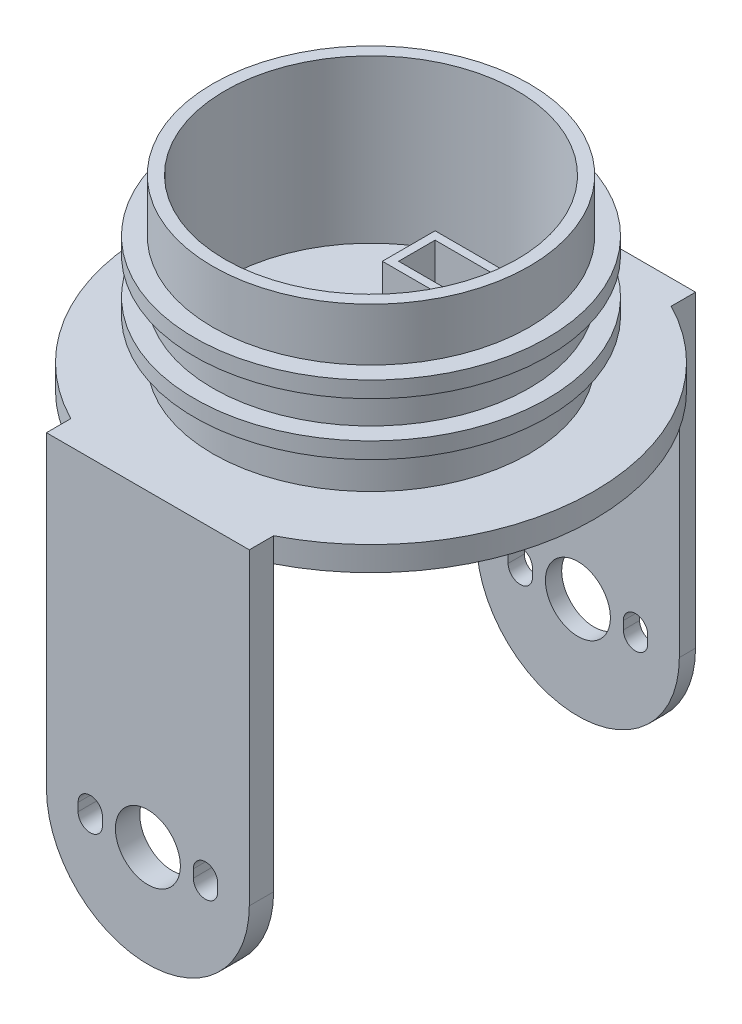
from build123d import *
from build123d.topology import SkipClean

# Parameters (mm, degrees)
SKETCH_1_R           = 19.5
SKETCH_1_R_2         = 18
EXTRUDE_1_DEPTH      = 20
SKETCH_3_R           = 27.5
EXTRUDE_2_DEPTH      = 3
EXTRUDE_START        = 2
SKETCH_25_R          = 21.75
SKETCH_25_R_2        = 19.5
EXTRUDE_12_DEPTH     = 2
EXTRUDE_START_2      = -1
SKETCH_26_R          = 21.75
SKETCH_26_R_2        = 19.5
EXTRUDE_13_DEPTH     = 2
SKETCH_27_W          = 25
SKETCH_27_H          = 51
EXTRUDE_14_DEPTH     = 3
SKETCH_28_R          = 4
EXTRUDE_17_DEPTH     = 2
EXTRUDE_START_3      = -53
SKETCH_28_15_R       = 4
EXTRUDE_19_DEPTH     = 53
SKETCH_32_W          = 2.204369859
SKETCH_32_H          = 3
EXTRUDE_20_DEPTH     = 2
CUT_EXTRUDE_START    = -50
SKETCH_28_18_R       = 4
CUT_EXTRUDE_8_DEPTH  = 50
SKETCH_33_W          = 25
SKETCH_33_H          = 3
EXTRUDE_21_DEPTH     = 3
SKETCH_34_W          = 10.2
SKETCH_34_H          = 6.5
SKETCH_34_W_2        = 8.2
SKETCH_34_H_2        = 4.5
EXTRUDE_22_DEPTH     = 5
SKETCH_37_W          = 8.2
SKETCH_37_H          = 4.5
CUT_EXTRUDE_9_DEPTH  = 5
SKETCH_38_R          = 6.3
SKETCH_38_R_2        = 4.8
EXTRUDE_23_DEPTH     = 9
CUT_EXTRUDE_10_DEPTH = 9.5
EXTRUDE_START_4      = 3
EXTRUDE_24_DEPTH     = 3


with BuildPart() as part:
    # 草圖1 → 填料-伸長1 (new body)
    with BuildSketch(Plane(origin=(0, 0, 0), x_dir=(1, 0, 0), z_dir=(0, 1, 0))):
        Circle(SKETCH_1_R)
        Circle(SKETCH_1_R_2, mode=Mode.SUBTRACT)
    extrude(amount=EXTRUDE_1_DEPTH)

    # 草圖3 → 填料-伸長2 (add)
    with BuildSketch(Plane.XZ):
        Circle(SKETCH_3_R)
    extrude(amount=EXTRUDE_2_DEPTH)

    # 草圖25 → 填料-伸長12 (add)
    with BuildSketch(Plane(origin=(0, 7, 0), x_dir=(-1, 0, 0), z_dir=(0, -1, 0)).offset(EXTRUDE_START)):
        Circle(SKETCH_25_R)
        Circle(SKETCH_25_R_2, mode=Mode.SUBTRACT)
    extrude(amount=-EXTRUDE_12_DEPTH)

    # 草圖26 → 填料-伸長13 (add)
    with BuildSketch(Plane(origin=(0, 10.5, 0), x_dir=(-1, 0, 0), z_dir=(0, -1, 0)).offset(EXTRUDE_START_2)):
        Circle(SKETCH_26_R)
        Circle(SKETCH_26_R_2, mode=Mode.SUBTRACT)
    extrude(amount=-EXTRUDE_13_DEPTH)

    # 草圖27 → 填料-伸長14 (add)
    with BuildSketch(Plane.XZ.offset(3)):
        Rectangle(SKETCH_27_W, SKETCH_27_H)
    extrude(amount=-EXTRUDE_14_DEPTH)

    # 草圖28 → 填料-伸長17 (add)
    with BuildSketch(Plane(origin=(0, 0, -25.5), x_dir=(-1, 0, 0), z_dir=(0, 0, -1))):
        with BuildLine():
            Line((12.5, 0), (-12.5, 0))
            Line((-12.5, 0), (-12.5, -38))
            ThreePointArc((-12.5, -38), (0, -50.5), (12.5, -38))
            Line((12.5, -38), (12.5, 0))
        make_face()
        with BuildLine():
            Line((8.6, -37.5), (8.6, -38.5))
            ThreePointArc((8.6, -38.5), (7.1, -40), (5.6, -38.5))
            Line((5.6, -38.5), (5.6, -37.5))
            ThreePointArc((5.6, -37.5), (7.1, -36), (8.6, -37.5))
        make_face(mode=Mode.SUBTRACT)
        with Locations((0, -38)):
            Circle(SKETCH_28_R, mode=Mode.SUBTRACT)
        with BuildLine():
            Line((-5.6, -37.5), (-5.6, -38.5))
            ThreePointArc((-5.6, -38.5), (-7.1, -40), (-8.6, -38.5))
            Line((-8.6, -38.5), (-8.6, -37.5))
            ThreePointArc((-8.6, -37.5), (-7.1, -36), (-5.6, -37.5))
        make_face(mode=Mode.SUBTRACT)
    extrude(amount=EXTRUDE_17_DEPTH)

    # 草圖28<15> → 填料-伸長19 (add)
    with BuildSketch(Plane(origin=(0, 0, -25.5), x_dir=(-1, 0, 0), z_dir=(0, 0, -1)).offset(EXTRUDE_START_3)):
        with BuildLine():
            Line((12.5, -38), (12.5, -3))
            Line((12.5, -3), (-12.5, -3))
            Line((-12.5, -3), (-12.5, -38))
            ThreePointArc((-12.5, -38), (0, -50.5), (12.5, -38))
        make_face()
        with BuildLine():
            Line((8.6, -37.5), (8.6, -38.5))
            ThreePointArc((8.6, -38.5), (7.1, -40), (5.6, -38.5))
            Line((5.6, -38.5), (5.6, -37.5))
            ThreePointArc((5.6, -37.5), (7.1, -36), (8.6, -37.5))
        make_face(mode=Mode.SUBTRACT)
        with Locations((0, -38)):
            Circle(SKETCH_28_15_R, mode=Mode.SUBTRACT)
        with BuildLine():
            Line((-5.6, -37.5), (-5.6, -38.5))
            ThreePointArc((-5.6, -38.5), (-7.1, -40), (-8.6, -38.5))
            Line((-8.6, -38.5), (-8.6, -37.5))
            ThreePointArc((-8.6, -37.5), (-7.1, -36), (-5.6, -37.5))
        make_face(mode=Mode.SUBTRACT)
    extrude(amount=EXTRUDE_19_DEPTH)

    # 草圖32 → 填料-伸長20 (add)
    with BuildSketch(Plane.XY.offset(25.5)):
        with Locations((11.397815071, -1.5)):
            Rectangle(SKETCH_32_W, SKETCH_32_H)
        with Locations((-11.397815071, -1.5)):
            Rectangle(SKETCH_32_W, SKETCH_32_H)
    extrude(amount=EXTRUDE_20_DEPTH)

    # 草圖28<18> → 除料-伸長8 (cut)
    with BuildSketch(Plane(origin=(0, 0, -25.5), x_dir=(-1, 0, 0), z_dir=(0, 0, -1)).offset(CUT_EXTRUDE_START)):
        with BuildLine():
            Line((12.5, -38), (12.5, -3))
            Line((12.5, -3), (-12.5, -3))
            Line((-12.5, -3), (-12.5, -38))
            ThreePointArc((-12.5, -38), (0, -50.5), (12.5, -38))
        make_face()
        with BuildLine():
            Line((8.6, -37.5), (8.6, -38.5))
            ThreePointArc((8.6, -38.5), (7.1, -40), (5.6, -38.5))
            Line((5.6, -38.5), (5.6, -37.5))
            ThreePointArc((5.6, -37.5), (7.1, -36), (8.6, -37.5))
        make_face(mode=Mode.SUBTRACT)
        with Locations((0, -38)):
            Circle(SKETCH_28_18_R, mode=Mode.SUBTRACT)
        with BuildLine():
            Line((-5.6, -37.5), (-5.6, -38.5))
            ThreePointArc((-5.6, -38.5), (-7.1, -40), (-8.6, -38.5))
            Line((-8.6, -38.5), (-8.6, -37.5))
            ThreePointArc((-8.6, -37.5), (-7.1, -36), (-5.6, -37.5))
        make_face(mode=Mode.SUBTRACT)
    extrude(amount=CUT_EXTRUDE_8_DEPTH, mode=Mode.SUBTRACT)

    # 草圖33 → 填料-伸長21 (add)
    with BuildSketch(Plane.XY.offset(27.5)):
        with Locations((0, -1.5)):
            Rectangle(SKETCH_33_W, SKETCH_33_H)
    extrude(amount=-EXTRUDE_21_DEPTH)

    # 草圖34 → 填料-伸長22 (add)
    with BuildSketch(Plane(origin=(0, 0, 0), x_dir=(1, 0, 0), z_dir=(0, 1, 0))):
        with Locations((0, 9.75)):
            Rectangle(SKETCH_34_W, SKETCH_34_H)
        with Locations((0, 9.75)):
            Rectangle(SKETCH_34_W_2, SKETCH_34_H_2, mode=Mode.SUBTRACT)
    extrude(amount=EXTRUDE_22_DEPTH)

    # 草圖37 → 除料-伸長9 (cut)
    with BuildSketch(Plane(origin=(0, 0, 0), x_dir=(1, 0, 0), z_dir=(0, 1, 0))):
        with Locations((0, 9.75)):
            Rectangle(SKETCH_37_W, SKETCH_37_H)
    extrude(amount=-CUT_EXTRUDE_9_DEPTH, mode=Mode.SUBTRACT)

    # 草圖38 → 填料-伸長23 (add)
    with BuildSketch(Plane(origin=(0, 0, -27.5), x_dir=(-1, 0, 0), z_dir=(0, 0, -1))):
        with Locations((0, -9.8)):
            Circle(SKETCH_38_R)
        with Locations((0, -9.8)):
            Circle(SKETCH_38_R_2, mode=Mode.SUBTRACT)
    extrude(amount=-EXTRUDE_23_DEPTH)

    # 草圖38<3> → 除料-伸長10 (cut)
    with BuildSketch(Plane(origin=(0, 0, -27.5), x_dir=(-1, 0, 0), z_dir=(0, 0, -1))):
        with BuildLine():
            ThreePointArc((4.8, -9.8), (-3.019933774, -6.069048379), (-1, -14.494677838))
            ThreePointArc((-1, -14.494677838), (0, -14.6), (1, -14.494677838))
            ThreePointArc((1, -14.494677838), (3.730951621, -12.819933774), (4.8, -9.8))
        make_face()
    extrude(amount=-CUT_EXTRUDE_10_DEPTH, mode=Mode.SUBTRACT)

    # 草圖38<4> → 填料-伸長24 (add)
    with SkipClean():  # the faces are left unmerged after this step: merging them gives an invalid solid
        with BuildSketch(Plane(origin=(0, 0, -27.5), x_dir=(-1, 0, 0), z_dir=(0, 0, -1)).offset(EXTRUDE_START_4)):
            with BuildLine():
                Line((-1.3125, -15.961764662), (-1, -14.494677838))
                ThreePointArc((-1, -14.494677838), (-3.019933774, -6.069048379), (4.8, -9.8))
                ThreePointArc((4.8, -9.8), (3.730951621, -12.819933774), (1, -14.494677838))
                Line((1, -14.494677838), (1.3125, -15.961764662))
                ThreePointArc((1.3125, -15.961764662), (4.896874003, -13.763663079), (6.3, -9.8))
                ThreePointArc((6.3, -9.8), (-3.963663079, -4.903125997), (-1.3125, -15.961764662))
            make_face()
        extrude(amount=-EXTRUDE_24_DEPTH)


solid = part.part
